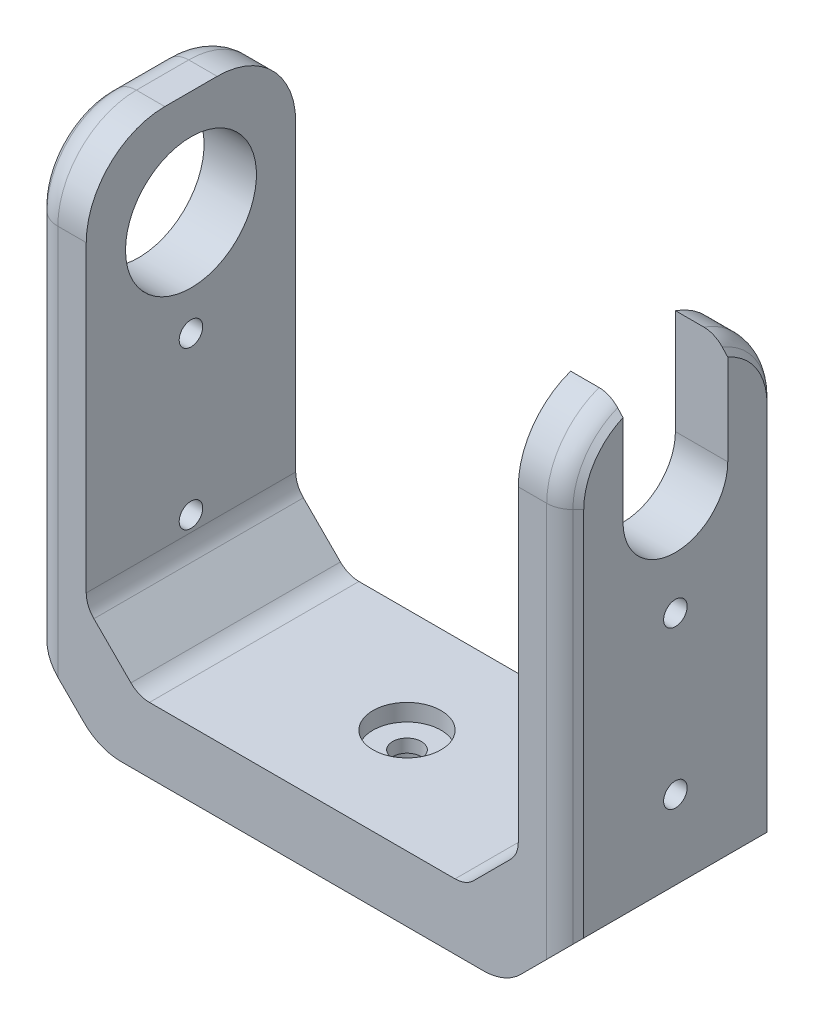
from build123d import *

# Parameters (mm, degrees)
SKETCH1_W           = 33
SKETCH1_H           = 16
SKETCH1_R           = 2.5
BOSS_EXTRUDE1_DEPTH = 2.7
SKETCH2_W           = 33
SKETCH2_H           = 16
SKETCH2_R           = 1.1
BOSS_EXTRUDE2_DEPTH = 2.3
SKETCH4_W           = 16
SKETCH4_H           = 39
SKETCH4_R           = 5
BOSS_EXTRUDE3_DEPTH = 4
BOSS_EXTRUDE4_DEPTH = 4
FILLET1_R           = 6
CHAMFER1_SIZE       = 4
SKETCH6_R           = 0.9
CUT_EXTRUDE1_DEPTH  = 59.804761712
CHAMFER2_SIZE       = 1
FILLET3_R           = 2
SKETCH7_R           = 2.6
CUT_EXTRUDE2_DEPTH  = 1.3
FILLET4_R           = 2
CHAMFER3_SIZE       = 5
FILLET7_R           = 4
CHAMFER4_SIZE       = 0.3


with BuildPart() as part:
    # Sketch1 → Boss-Extrude1 (new body)
    with BuildSketch(Plane(origin=(0, 0, 0), x_dir=(1, 0, 0), z_dir=(0, 1, 0))):
        with Locations((16.5, 8)):
            Rectangle(SKETCH1_W, SKETCH1_H)
        with Locations(Location((16.5, 8, 0), (0, 0, 90))):
            Circle(SKETCH1_R, mode=Mode.SUBTRACT)
    extrude(amount=BOSS_EXTRUDE1_DEPTH)

    # Sketch2 → Boss-Extrude2 (add)
    with BuildSketch(Plane(origin=(0, 2.7, 0), x_dir=(1, 0, 0), z_dir=(0, 1, 0))):
        with Locations((16.5, 8)):
            Rectangle(SKETCH2_W, SKETCH2_H)
        with Locations(Location((16.5, 8, 0), (0, 0, 270))):
            Circle(SKETCH2_R, mode=Mode.SUBTRACT)
    extrude(amount=BOSS_EXTRUDE2_DEPTH)

    # Sketch4 → Boss-Extrude3 (add)
    with BuildSketch(Plane.ZY):
        with Locations((-8, 19.5)):
            Rectangle(SKETCH4_W, SKETCH4_H)
        with Locations((-8, 31)):
            Circle(SKETCH4_R, mode=Mode.SUBTRACT)
    extrude(amount=BOSS_EXTRUDE3_DEPTH)

    # Sketch5 → Boss-Extrude4 (add)
    with BuildSketch(Plane(origin=(33, 0, 0), x_dir=(0, 0, -1), z_dir=(1, 0, 0))):
        with BuildLine():
            Line((0, 39), (4, 39))
            Line((4, 39), (4, 31))
            ThreePointArc((4, 31), (8, 27), (12, 31))
            Line((12, 31), (12, 39))
            Line((12, 39), (16, 39))
            Line((16, 39), (16, 0))
            Line((16, 0), (0, 0))
            Line((0, 0), (0, 39))
        make_face()
    extrude(amount=BOSS_EXTRUDE4_DEPTH)

    # Fillet1
    # the kernel refuses this fillet: 6 mm, written as the material it takes off along each edge
    with BuildSketch(Plane(origin=(18.857864376, 39, -16), x_dir=(0, -1, 0), z_dir=(1, 0, 0))) as fillet1_piece_1:
        with BuildLine():
            CenterArc((5.656854249, -6), FILLET1_R, 90, 70.528779366)
            Line((0, -4), (-0.113137085, -3.96))
            ThreePointArc((-0.113137085, -3.96), (-0.12, -2), (-0.12, 0))
            Line((-0.12, 0), (0, 0.12))
            Line((0, 0.12), (5.656854249, 0.12))
            Line((5.656854249, 0.12), (5.656854249, 0))
        make_face()
    extrude(amount=32.284271247, mode=Mode.SUBTRACT)
    with BuildSketch(Plane(origin=(15, 39, -16), x_dir=(0, -1, 0), z_dir=(-1, 0, 0))) as fillet1_piece_2:
        with BuildLine():
            CenterArc((FILLET1_R, FILLET1_R), FILLET1_R, 180, 90)
            Line((0, FILLET1_R), (-FILLET1_R * 0.02, FILLET1_R))
            Line((-FILLET1_R * 0.02, FILLET1_R), (-FILLET1_R * 0.02, -FILLET1_R * 0.02))
            Line((-FILLET1_R * 0.02, -FILLET1_R * 0.02), (FILLET1_R, -FILLET1_R * 0.02))
            Line((FILLET1_R, -FILLET1_R * 0.02), (FILLET1_R, 0))
        make_face()
    extrude(amount=34, mode=Mode.SUBTRACT)
    with BuildSketch(Plane(origin=(18.857864376, 39, 0), x_dir=(0, -1, 0), z_dir=(1, 0, 0))) as fillet1_piece_3:
        with BuildLine():
            CenterArc((5.656854249, 6), FILLET1_R, 199.471220634, 70.528779366)
            Line((0, 4), (-0.113137085, 3.96))
            ThreePointArc((-0.113137085, 3.96), (-0.12, 2), (-0.12, 0))
            Line((-0.12, 0), (0, -0.12))
            Line((0, -0.12), (5.656854249, -0.12))
            Line((5.656854249, -0.12), (5.656854249, 0))
        make_face()
    extrude(amount=32.284271247, mode=Mode.SUBTRACT)
    with BuildSketch(Plane(origin=(15, 39, 0), x_dir=(0, -1, 0), z_dir=(-1, 0, 0))) as fillet1_piece_4:
        with BuildLine():
            CenterArc((FILLET1_R, -FILLET1_R), FILLET1_R, 90, 90)
            Line((0, -FILLET1_R), (-FILLET1_R * 0.02, -FILLET1_R))
            Line((-FILLET1_R * 0.02, -FILLET1_R), (-FILLET1_R * 0.02, FILLET1_R * 0.02))
            Line((-FILLET1_R * 0.02, FILLET1_R * 0.02), (FILLET1_R, FILLET1_R * 0.02))
            Line((FILLET1_R, FILLET1_R * 0.02), (FILLET1_R, 0))
        make_face()
    extrude(amount=34, mode=Mode.SUBTRACT)

    # Chamfer1
    chamfer1_edges = [part.edges().sort_by_distance(p)[0] for p in [
        (0, 5, -8),
        (33, 5, -8),
    ]]
    chamfer(chamfer1_edges, length=CHAMFER1_SIZE)

    # Sketch6 → Cut-Extrude1 (cut, through all)
    with BuildSketch(Plane.ZY.offset(4)):
        with Locations((-8, 23)):
            Circle(SKETCH6_R)
        with Locations((-8, 11)):
            Circle(SKETCH6_R)
    extrude(amount=-CUT_EXTRUDE1_DEPTH, mode=Mode.SUBTRACT)

    # Chamfer2
    chamfer2_edges = [part.edges().sort_by_distance(p)[0] for p in [
        (-4, 16.5, 0),
        (37, 16.671572875, -16),
        (-4, 16.5, -16),
        (37, 16.671572875, 0),
        (37, 36.807247366, -1.101020514),
        (37, 36.807247366, -14.898979486),
        (-4, 39, -8),
        (-4, 37.242640687, -1.757359313),
        (-4, 37.242640687, -14.242640687),
    ]]
    chamfer(chamfer2_edges, length=CHAMFER2_SIZE)

    # Fillet3
    fillet3_edges = [part.edges().sort_by_distance(p)[0] for p in [
        (36, 16.671572875, -16),
        (36, 16.671572875, 0),
        (-3, 16.5, -16),
        (-3, 37.242640687, -14.242640687),
        (-3, 16.5, 0),
        (-3, 37.242640687, -1.757359313),
        (36, 36.807247366, -14.898979486),
        (36, 36.807247366, -1.101020514),
        (-3, 39, -8),
    ]]
    fillet(fillet3_edges, radius=FILLET3_R)

    # Sketch7 → Cut-Extrude2 (cut)
    with BuildSketch(Plane(origin=(0, 5, 0), x_dir=(1, 0, 0), z_dir=(0, 1, 0))):
        with Locations(Location((16.5, 8, 0), (0, 0, 270))):
            Circle(SKETCH7_R)
    extrude(amount=-CUT_EXTRUDE2_DEPTH, mode=Mode.SUBTRACT)

    # Fillet4
    fillet4_edges = [part.edges().sort_by_distance(p)[0] for p in [
        (29, 5, -8),
        (33, 9, -8),
        (0, 9, -8),
        (4, 5, -8),
    ]]
    fillet(fillet4_edges, radius=FILLET4_R)

    # Chamfer3
    chamfer3_edges = [part.edges().sort_by_distance(p)[0] for p in [
        (37, 0, -8),
        (-4, 0, -8),
    ]]
    chamfer(chamfer3_edges, length=CHAMFER3_SIZE)

    # Fillet7
    fillet7_edges = [part.edges().sort_by_distance(p)[0] for p in [
        (1, 0, -8),
        (32, 0, -8),
    ]]
    fillet(fillet7_edges, radius=FILLET7_R)

    # Chamfer4
    chamfer4_edges = [part.edges().sort_by_distance(p)[0] for p in [
        (16.5, 0, -5.5),
    ]]
    chamfer(chamfer4_edges, length=CHAMFER4_SIZE)


solid = part.part
